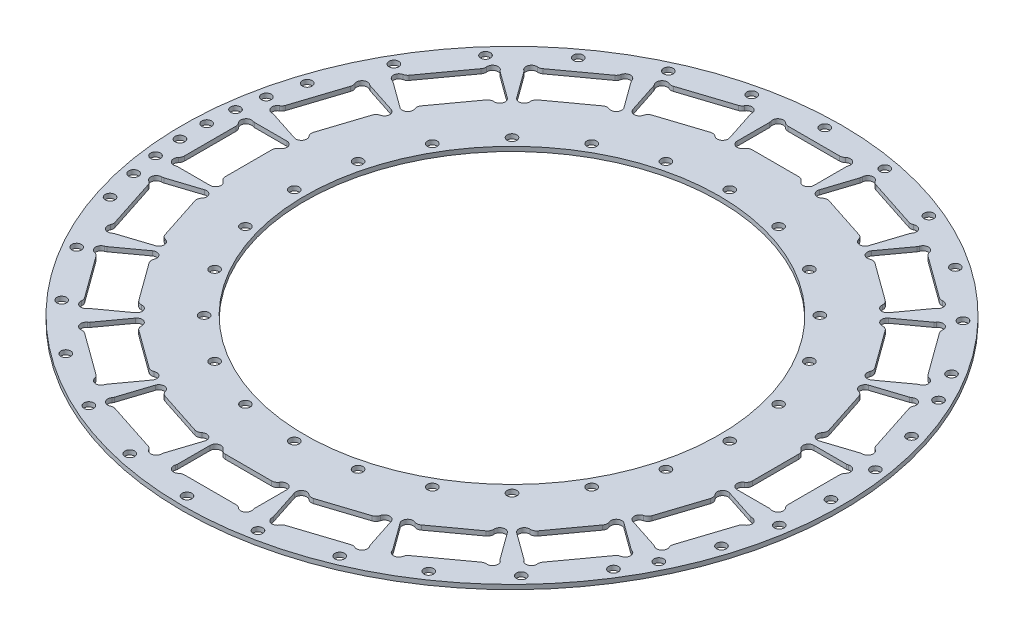
from build123d import *

# Parameters (mm, degrees)
SKETCH1_W                      = 40.5
SKETCH1_H                      = 1.5
MAGNETSLOT_DEPTH               = 155.156576246
FILLET1_R                      = 2
MAGNETSLOTPATTERN_COUNT        = 20
FILLET1_OF_MAGNETSLOTPATTERN_R = 2
SKETCH3_R                      = 1.6
BEARINGSCREW_DEPTH             = 155.156576246
BEARINGSCREWPATTERN_START      = 4.675
BEARINGSCREWPATTERN_OUTLINE_R  = 1.6
BEARINGSCREWPATTERN_DEPTH      = 1.5
SKETCH5_R                      = 1.6
CUT_EXTRUDE4_DEPTH             = 155.156576246


# Read off the part's stored shape, not the designer's step: BearingScrewPattern
with BuildPart() as part:
    # Sketch1 → BaseRevolve (revolve)
    with BuildSketch(Plane.XY, mode=Mode.PRIVATE) as baserevolve_sk:
        with Locations((-88.75, 5.425)):
            Rectangle(SKETCH1_W, SKETCH1_H)
    revolve(baserevolve_sk.sketch.rotate(Axis((0, -200069.047495165, 0), (0, 1, 0)), 270), axis=Axis((0, -200069.047495165, 0), (0, 1, 0)))

    # Sketch2 → MagnetSlot (cut, through all)
    with BuildSketch(Plane(origin=(0, 6.175, 0), x_dir=(1, 0, 0), z_dir=(0, 1, 0))):
        with BuildLine():
            Line((-9.480062112, 99.85), (9.480062112, 99.85))
            ThreePointArc((9.480062112, 99.85), (11.895015528, 100.654984472), (12.7, 98.240031056))
            Line((12.7, 98.240031056), (12.7, 87.15))
            ThreePointArc((12.7, 87.15), (10.9, 85.35), (9.1, 87.15))
            Line((9.1, 87.15), (-9.1, 87.15))
            ThreePointArc((-9.1, 87.15), (-10.9, 85.35), (-12.7, 87.15))
            Line((-12.7, 87.15), (-12.7, 98.240031056))
            ThreePointArc((-12.7, 98.240031056), (-11.895015528, 100.654984472), (-9.480062112, 99.85))
        make_face()
    magnetslot = extrude(amount=-MAGNETSLOT_DEPTH, mode=Mode.SUBTRACT)

    # Fillet1
    fillet1_edges = [part.edges().sort_by_distance(p)[0] for p in [
        (9.1, 5.425, -87.15),
        (-9.1, 5.425, -87.15),
        (-12.7, 5.425, -98.240031056),
        (-9.480062112, 5.425, -99.85),
        (9.480062112, 5.425, -99.85),
        (12.7, 5.425, -98.240031056),
    ]]
    fillet(fillet1_edges, radius=FILLET1_R)

    # MagnetSlotPattern: MagnetSlot ×20 about axis
    magnetslotpattern_axis = Axis((0, 0, 0), (0, 1, 0))
    for i in range(1, MAGNETSLOTPATTERN_COUNT):
        add(magnetslot.rotate(magnetslotpattern_axis, i * 360 / MAGNETSLOTPATTERN_COUNT), mode=Mode.SUBTRACT)

    # Fillet1 of MagnetSlotPattern
    fillet1_of_magnetslotpattern_edges = [part.edges().sort_by_distance(p)[0] for p in [
        (-18.276216761, 5.425, -85.696630044),
        (-35.585445358, 5.425, -80.072520746),
        (-42.436256881, 5.425, -89.507305868),
        (-39.871421735, 5.425, -92.033492852),
        (-21.839272041, 5.425, -97.892493453),
        (-18.279421367, 5.425, -97.356337526),
        (-43.863430088, 5.425, -75.854676856),
        (-58.587539386, 5.425, -65.156985264),
        (-68.018557268, 5.425, -72.012981948),
        (-66.359888798, 5.425, -75.208106188),
        (-51.020826085, 5.425, -86.352587589),
        (-47.469525611, 5.425, -86.942727357),
        (-65.156985264, 5.425, -58.587539386),
        (-75.854676856, 5.425, -43.863430088),
        (-86.942727357, 5.425, -47.469525611),
        (-86.352587589, 5.425, -51.020826085),
        (-75.208106188, 5.425, -66.359888798),
        (-72.012981948, 5.425, -68.018557268),
        (-80.072520746, 5.425, -35.585445358),
        (-85.696630044, 5.425, -18.276216761),
        (-97.356337526, 5.425, -18.279421367),
        (-97.892493453, 5.425, -21.839272041),
        (-92.033492852, 5.425, -39.871421735),
        (-89.507305868, 5.425, -42.436256881),
        (-87.15, 5.425, -9.1),
        (-87.15, 5.425, 9.1),
        (-98.240031056, 5.425, 12.7),
        (-99.85, 5.425, 9.480062112),
        (-99.85, 5.425, -9.480062112),
        (-98.240031056, 5.425, -12.7),
        (-85.696630044, 5.425, 18.276216761),
        (-80.072520746, 5.425, 35.585445358),
        (-89.507305868, 5.425, 42.436256881),
        (-92.033492852, 5.425, 39.871421735),
        (-97.892493453, 5.425, 21.839272041),
        (-97.356337526, 5.425, 18.279421367),
        (-75.854676856, 5.425, 43.863430088),
        (-65.156985264, 5.425, 58.587539386),
        (-72.012981948, 5.425, 68.018557268),
        (-75.208106188, 5.425, 66.359888798),
        (-86.352587589, 5.425, 51.020826085),
        (-86.942727357, 5.425, 47.469525611),
        (-58.587539386, 5.425, 65.156985264),
        (-43.863430088, 5.425, 75.854676856),
        (-47.469525611, 5.425, 86.942727357),
        (-51.020826085, 5.425, 86.352587589),
        (-66.359888798, 5.425, 75.208106188),
        (-68.018557268, 5.425, 72.012981948),
        (-35.585445358, 5.425, 80.072520746),
        (-18.276216761, 5.425, 85.696630044),
        (-18.279421367, 5.425, 97.356337526),
        (-21.839272041, 5.425, 97.892493453),
        (-39.871421735, 5.425, 92.033492852),
        (-42.436256881, 5.425, 89.507305868),
        (-9.1, 5.425, 87.15),
        (9.1, 5.425, 87.15),
        (12.7, 5.425, 98.240031056),
        (9.480062112, 5.425, 99.85),
        (-9.480062112, 5.425, 99.85),
        (-12.7, 5.425, 98.240031056),
        (18.276216761, 5.425, 85.696630044),
        (35.585445358, 5.425, 80.072520746),
        (42.436256881, 5.425, 89.507305868),
        (39.871421735, 5.425, 92.033492852),
        (21.839272041, 5.425, 97.892493453),
        (18.279421367, 5.425, 97.356337526),
        (43.863430088, 5.425, 75.854676856),
        (58.587539386, 5.425, 65.156985264),
        (68.018557268, 5.425, 72.012981948),
        (66.359888798, 5.425, 75.208106188),
        (51.020826085, 5.425, 86.352587589),
        (47.469525611, 5.425, 86.942727357),
        (65.156985264, 5.425, 58.587539386),
        (75.854676856, 5.425, 43.863430088),
        (86.942727357, 5.425, 47.469525611),
        (86.352587589, 5.425, 51.020826085),
        (75.208106188, 5.425, 66.359888798),
        (72.012981948, 5.425, 68.018557268),
        (80.072520746, 5.425, 35.585445358),
        (85.696630044, 5.425, 18.276216761),
        (97.356337526, 5.425, 18.279421367),
        (97.892493453, 5.425, 21.839272041),
        (92.033492852, 5.425, 39.871421735),
        (89.507305868, 5.425, 42.436256881),
        (87.15, 5.425, 9.1),
        (87.15, 5.425, -9.1),
        (98.240031056, 5.425, -12.7),
        (99.85, 5.425, -9.480062112),
        (99.85, 5.425, 9.480062112),
        (98.240031056, 5.425, 12.7),
        (85.696630044, 5.425, -18.276216761),
        (80.072520746, 5.425, -35.585445358),
        (89.507305868, 5.425, -42.436256881),
        (92.033492852, 5.425, -39.871421735),
        (97.892493453, 5.425, -21.839272041),
        (97.356337526, 5.425, -18.279421367),
        (75.854676856, 5.425, -43.863430088),
        (65.156985264, 5.425, -58.587539386),
        (72.012981948, 5.425, -68.018557268),
        (75.208106188, 5.425, -66.359888798),
        (86.352587589, 5.425, -51.020826085),
        (86.942727357, 5.425, -47.469525611),
        (58.587539386, 5.425, -65.156985264),
        (43.863430088, 5.425, -75.854676856),
        (47.469525611, 5.425, -86.942727357),
        (51.020826085, 5.425, -86.352587589),
        (66.359888798, 5.425, -75.208106188),
        (68.018557268, 5.425, -72.012981948),
        (35.585445358, 5.425, -80.072520746),
        (18.276216761, 5.425, -85.696630044),
        (18.279421367, 5.425, -97.356337526),
        (21.839272041, 5.425, -97.892493453),
        (39.871421735, 5.425, -92.033492852),
        (42.436256881, 5.425, -89.507305868),
    ]]
    fillet(fillet1_of_magnetslotpattern_edges, radius=FILLET1_OF_MAGNETSLOTPATTERN_R)

    # Sketch3 → BearingScrew (cut, through all)
    with BuildSketch(Plane(origin=(0, 6.175, 0), x_dir=(1, 0, 0), z_dir=(0, 1, 0))):
        with Locations(Location((0, 72, 0), (0, 0, 270))):
            Circle(SKETCH3_R)
    extrude(amount=-BEARINGSCREW_DEPTH, mode=Mode.SUBTRACT)

    # BearingScrewPattern outline → BearingScrewPattern (cut)
    with BuildSketch(Plane(origin=(0, 0, 0), x_dir=(1, 0, 0), z_dir=(0, 1, 0)).offset(BEARINGSCREWPATTERN_START)):
        with Locations((18.634971247, 69.546659493)):
            Circle(BEARINGSCREWPATTERN_OUTLINE_R)
        with Locations((-18.634971247, 69.546659493)):
            Circle(BEARINGSCREWPATTERN_OUTLINE_R)
        with Locations((-36, 62.353829072)):
            Circle(BEARINGSCREWPATTERN_OUTLINE_R)
        with Locations((-50.911688245, 50.911688245)):
            Circle(BEARINGSCREWPATTERN_OUTLINE_R)
        with Locations((-62.353829072, 36)):
            Circle(BEARINGSCREWPATTERN_OUTLINE_R)
        with Locations((-69.546659493, 18.634971247)):
            Circle(BEARINGSCREWPATTERN_OUTLINE_R)
        with Locations((-72, 0)):
            Circle(BEARINGSCREWPATTERN_OUTLINE_R)
        with Locations((36, 62.353829072)):
            Circle(BEARINGSCREWPATTERN_OUTLINE_R)
        with Locations((50.911688245, 50.911688245)):
            Circle(BEARINGSCREWPATTERN_OUTLINE_R)
        with Locations((62.353829072, 36)):
            Circle(BEARINGSCREWPATTERN_OUTLINE_R)
        with Locations((69.546659493, 18.634971247)):
            Circle(BEARINGSCREWPATTERN_OUTLINE_R)
        with Locations((72, 0)):
            Circle(BEARINGSCREWPATTERN_OUTLINE_R)
        with Locations((69.546659493, -18.634971247)):
            Circle(BEARINGSCREWPATTERN_OUTLINE_R)
        with Locations((62.353829072, -36)):
            Circle(BEARINGSCREWPATTERN_OUTLINE_R)
        with Locations((50.911688245, -50.911688245)):
            Circle(BEARINGSCREWPATTERN_OUTLINE_R)
        with Locations((36, -62.353829072)):
            Circle(BEARINGSCREWPATTERN_OUTLINE_R)
        with Locations((18.634971247, -69.546659493)):
            Circle(BEARINGSCREWPATTERN_OUTLINE_R)
        with Locations((0, -72)):
            Circle(BEARINGSCREWPATTERN_OUTLINE_R)
        with Locations((-18.634971247, -69.546659493)):
            Circle(BEARINGSCREWPATTERN_OUTLINE_R)
        with Locations((-36, -62.353829072)):
            Circle(BEARINGSCREWPATTERN_OUTLINE_R)
        with Locations((-50.911688245, -50.911688245)):
            Circle(BEARINGSCREWPATTERN_OUTLINE_R)
        with Locations((-62.353829072, -36)):
            Circle(BEARINGSCREWPATTERN_OUTLINE_R)
        with Locations((-69.546659493, -18.634971247)):
            Circle(BEARINGSCREWPATTERN_OUTLINE_R)
    extrude(amount=BEARINGSCREWPATTERN_DEPTH, mode=Mode.SUBTRACT)

    # Sketch5 → Cut-Extrude4 (cut, through all)
    with BuildSketch(Plane(origin=(0, 6.175, 0), x_dir=(1, 0, 0), z_dir=(0, 1, 0))):
        with Locations(Location((-103.194571877, -21.934683381, 0), (0, 0, 270))):
            Circle(SKETCH5_R)
        with Locations(Location((-105.407458575, -4.417881468, 0), (0, 0, 270))):
            Circle(SKETCH5_R)
        with Locations(Location((-104.668100989, -13.222656141, 0), (0, 0, 270))):
            Circle(SKETCH5_R)
        with Locations(Location((-100.336462469, 32.601292907, 0), (0, 0, 270))):
            Circle(SKETCH5_R)
        with Locations(Location((104.295371407, 15.897342642, 0), (0, 0, 270))):
            Circle(SKETCH5_R)
        with Locations(Location((100.708995202, 31.43164465, 0), (0, 0, 270))):
            Circle(SKETCH5_R)
        with Locations(Location((94.822771885, 46.248155986, 0), (0, 0, 270))):
            Circle(SKETCH5_R)
        with Locations(Location((-103.194571877, 21.934683381, 0), (0, 0, 270))):
            Circle(SKETCH5_R)
        with Locations(Location((-104.668100989, 13.222656141, 0), (0, 0, 270))):
            Circle(SKETCH5_R)
        with Locations(Location((-105.407458575, 4.417881468, 0), (0, 0, 270))):
            Circle(SKETCH5_R)
        with Locations(Location((89.469074145, -55.906482377, 0), (0, 0, 270))):
            Circle(SKETCH5_R)
        with Locations(Location((-44.130594647, 95.826617472, 0), (0, 0, 270))):
            Circle(SKETCH5_R)
        with Locations(Location((-62.82106423, 84.757087545, 0), (0, 0, 270))):
            Circle(SKETCH5_R)
        with Locations(Location((-78.848228037, 70.094271773, 0), (0, 0, 270))):
            Circle(SKETCH5_R)
        with Locations(Location((-91.532612735, 52.45980181, 0), (0, 0, 270))):
            Circle(SKETCH5_R)
        with Locations(Location((94.822771885, -46.248155986, 0), (0, 0, 270))):
            Circle(SKETCH5_R)
        with Locations(Location((100.708995202, -31.43164465, 0), (0, 0, 270))):
            Circle(SKETCH5_R)
        with Locations(Location((104.295371407, -15.897342642, 0), (0, 0, 270))):
            Circle(SKETCH5_R)
        with Locations(Location((105.5, 0, 0), (0, 0, 270))):
            Circle(SKETCH5_R)
        with Locations(Location((76.122528254, -73.04526468, 0), (0, 0, 270))):
            Circle(SKETCH5_R)
        with Locations(Location((89.469074145, 55.906482377, 0), (0, 0, 270))):
            Circle(SKETCH5_R)
        with Locations(Location((76.122528254, 73.04526468, 0), (0, 0, 270))):
            Circle(SKETCH5_R)
        with Locations(Location((59.54875959, 87.08728513, 0), (0, 0, 270))):
            Circle(SKETCH5_R)
        with Locations(Location((40.450414858, 97.437230758, 0), (0, 0, 270))):
            Circle(SKETCH5_R)
        with Locations(Location((19.637170436, 103.656314507, 0), (0, 0, 270))):
            Circle(SKETCH5_R)
        with Locations(Location((-2.008593938, 105.480877653, 0), (0, 0, 270))):
            Circle(SKETCH5_R)
        with Locations(Location((-23.569203757, 102.833567643, 0), (0, 0, 270))):
            Circle(SKETCH5_R)
        with Locations(Location((-91.532612735, -52.45980181, 0), (0, 0, 270))):
            Circle(SKETCH5_R)
        with Locations(Location((-62.82106423, -84.757087545, 0), (0, 0, 270))):
            Circle(SKETCH5_R)
        with Locations(Location((-44.130594647, -95.826617472, 0), (0, 0, 270))):
            Circle(SKETCH5_R)
        with Locations(Location((-23.569203757, -102.833567643, 0), (0, 0, 270))):
            Circle(SKETCH5_R)
        with Locations(Location((-2.008593938, -105.480877653, 0), (0, 0, 270))):
            Circle(SKETCH5_R)
        with Locations(Location((19.637170436, -103.656314507, 0), (0, 0, 270))):
            Circle(SKETCH5_R)
        with Locations(Location((40.450414858, -97.437230758, 0), (0, 0, 270))):
            Circle(SKETCH5_R)
        with Locations(Location((59.54875959, -87.08728513, 0), (0, 0, 270))):
            Circle(SKETCH5_R)
        with Locations(Location((-78.848228037, -70.094271773, 0), (0, 0, 270))):
            Circle(SKETCH5_R)
        with Locations(Location((-100.336462469, -32.601292907, 0), (0, 0, 270))):
            Circle(SKETCH5_R)
    extrude(amount=-CUT_EXTRUDE4_DEPTH, mode=Mode.SUBTRACT)


solid = part.part
